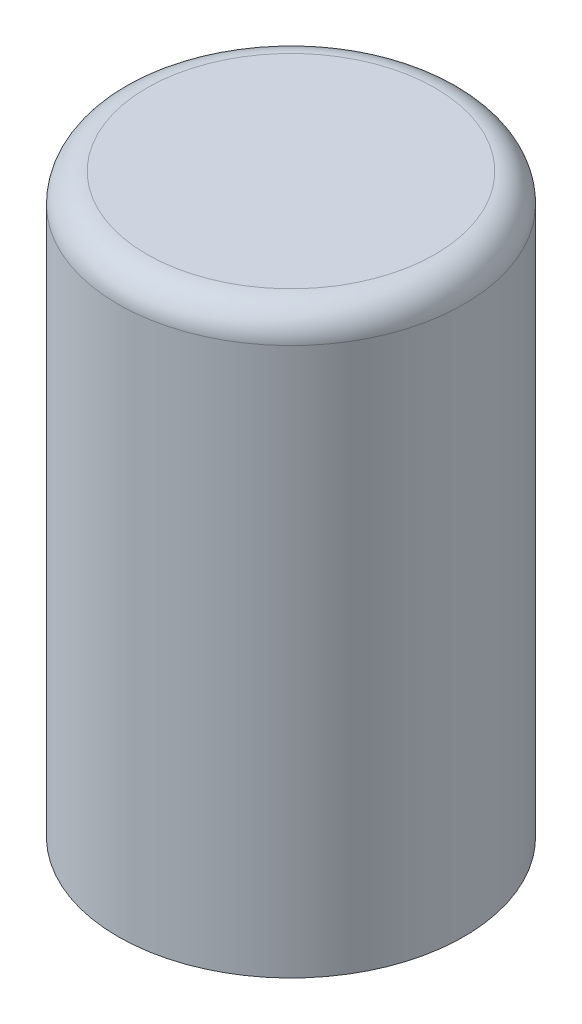
from build123d import *

# Parameters (mm, degrees)
SKETCH1_R           = 6
BOSS_EXTRUDE1_DEPTH = 20
CUT_EXTRUDE1_DEPTH  = 10
CUT_EXTRUDE2_DEPTH  = 3
CHAMFER1_SIZE       = 1
CHAMFER2_SIZE       = 1
FILLET1_R           = 1


with BuildPart() as part:
    # Sketch1 → Boss-Extrude1 (new body)
    with BuildSketch(Plane(origin=(0, 0, 0), x_dir=(1, 0, 0), z_dir=(0, 1, 0))):
        with Locations(Location((0, 0, 0), (0, 0, 270))):
            Circle(SKETCH1_R)
    extrude(amount=BOSS_EXTRUDE1_DEPTH)

    # Sketch2 → Cut-Extrude1 (cut)
    with BuildSketch(Plane.XZ):
        with BuildLine():
            Line((-3.228638435, -1.351256398), (3.447764562, -0.602428024))
            ThreePointArc((3.447764562, -0.602428024), (0.390115429, -3.478190615), (-3.228638435, -1.351256398))
        make_face()
        with BuildLine():
            Line((-3.447764562, 0.602428024), (3.228638435, 1.351256398))
            ThreePointArc((3.228638435, 1.351256398), (-0.390115429, 3.478190615), (-3.447764562, 0.602428024))
        make_face()
    extrude(amount=-CUT_EXTRUDE1_DEPTH, mode=Mode.SUBTRACT)

    # Sketch3 → Cut-Extrude2 (cut)
    with BuildSketch(Plane.XZ):
        with BuildLine():
            Line((-3.447764562, 0.602428024), (3.228638435, 1.351256398))
            ThreePointArc((3.228638435, 1.351256398), (3.478190615, 0.390115429), (3.447764562, -0.602428024))
            Line((3.447764562, -0.602428024), (-3.228638435, -1.351256398))
            ThreePointArc((-3.228638435, -1.351256398), (-3.478190615, -0.390115429), (-3.447764562, 0.602428024))
        make_face()
    extrude(amount=-CUT_EXTRUDE2_DEPTH, mode=Mode.SUBTRACT)

    # Chamfer1
    chamfer1_edges = [part.edges().sort_by_distance(p)[0] for p in [
        (-0.390115429, 10, 3.478190615),
        (-0.109563063, 10, 0.976842211),
        (0.390115429, 10, -3.478190615),
        (0.109563063, 10, -0.976842211),
    ]]
    chamfer(chamfer1_edges, length=CHAMFER1_SIZE)

    # Chamfer2
    # the kernel refuses this chamfer: 1 mm, written as the material it adds along each edge
    with BuildSketch(Plane(origin=(0, 3, 0), x_dir=(-0.42559561828763903, 0, -0.9049134597818524), z_dir=(0.9049134597818524, 0, -0.42559561828763903))) as chamfer2_piece_1_section:
        Polygon((3.5, -CHAMFER2_SIZE), (3.5 - CHAMFER2_SIZE, 0), (3.5, 0), align=None)
    chamfer2_piece_1 = revolve(axis=Axis((0, 3, 0), (0, 1, 0)), revolution_arc=116.82411124, mode=Mode.PRIVATE)
    chamfer2_piece_1 = split(chamfer2_piece_1, bisect_by=Plane(origin=(-2.987774237, 2.670615871, -1.324240961), z_dir=(-0.11146155122457255, 0, 0.9937687470425964)), keep=Keep.TOP, mode=Mode.PRIVATE)
    chamfer2_piece_1 = split(chamfer2_piece_1, bisect_by=Plane(origin=(-3.206900364, 2.670615871, 0.629443462), z_dir=(0.11146155122457255, 0, -0.9937687470425964)), keep=Keep.TOP, mode=Mode.PRIVATE)
    add(chamfer2_piece_1)
    with BuildSketch(Plane(origin=(0, 3, 0), x_dir=(0.4255956182876634, 0, 0.904913459781841), z_dir=(-0.904913459781841, 0, 0.4255956182876634))) as chamfer2_piece_2_section:
        Polygon((3.5, -CHAMFER2_SIZE), (3.5 - CHAMFER2_SIZE, 0), (3.5, 0), align=None)
    chamfer2_piece_2 = revolve(axis=Axis((0, 3, 0), (0, 1, 0)), revolution_arc=116.82411124, mode=Mode.PRIVATE)
    chamfer2_piece_2 = split(chamfer2_piece_2, bisect_by=Plane(origin=(3.206900364, 2.670615871, -0.629443462), z_dir=(-0.11146155122457255, 0, 0.9937687470425964)), keep=Keep.TOP, mode=Mode.PRIVATE)
    chamfer2_piece_2 = split(chamfer2_piece_2, bisect_by=Plane(origin=(2.987774237, 2.670615871, 1.324240961), z_dir=(0.11146155122457255, 0, -0.9937687470425964)), keep=Keep.TOP, mode=Mode.PRIVATE)
    add(chamfer2_piece_2)

    # Fillet1
    fillet1_edges = [part.edges().sort_by_distance(p)[0] for p in [
        (0, 20, -6),
    ]]
    fillet(fillet1_edges, radius=FILLET1_R)


solid = part.part
